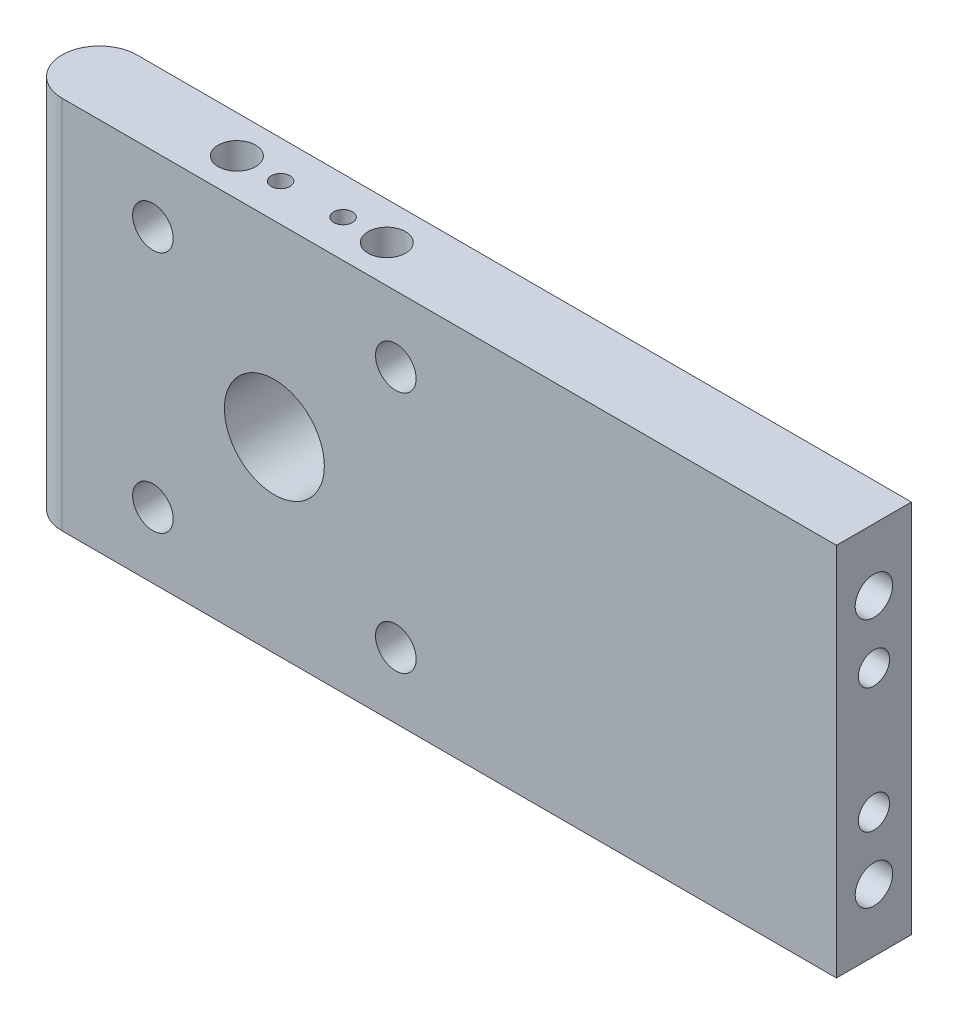
from build123d import *

# Parameters (mm, degrees)
SKETCH1_W           = 130
SKETCH1_H           = 60
SKETCH1_R           = 8
SKETCH1_R_2         = 3.25
BOSS_EXTRUDE1_DEPTH = 12
FILLET1_R           = 6
SKETCH2_R           = 3
SKETCH2_R_2         = 2.5
CUT_EXTRUDE1_DEPTH  = 20
SKETCH3_R           = 3
SKETCH3_R_2         = 1.5
CUT_EXTRUDE2_DEPTH  = 15


with BuildPart() as part:
    # Sketch1 → Boss-Extrude1 (new body)
    with BuildSketch(Plane.XY):
        Rectangle(SKETCH1_W, SKETCH1_H)
        with Locations((-25, 0)):
            Circle(SKETCH1_R, mode=Mode.SUBTRACT)
        with Locations((-5.554563517, 19.445436483)):
            Circle(SKETCH1_R_2, mode=Mode.SUBTRACT)
        with Locations((-44.445436483, 19.445436483)):
            Circle(SKETCH1_R_2, mode=Mode.SUBTRACT)
        with Locations(Location((-44.445436483, -19.445436483, 0), (0, 0, 180))):
            Circle(SKETCH1_R_2, mode=Mode.SUBTRACT)
        with Locations(Location((-5.554563517, -19.445436483, 0), (0, 0, 180))):
            Circle(SKETCH1_R_2, mode=Mode.SUBTRACT)
    extrude(amount=BOSS_EXTRUDE1_DEPTH)

    # Fillet1
    fillet1_edges = [part.edges().sort_by_distance(p)[0] for p in [
        (-65, 0, 0),
        (-65, 0, 12),
    ]]
    fillet(fillet1_edges, radius=FILLET1_R - 0.0001)  # a hair under: the kernel refuses the full size

    # Sketch2 → Cut-Extrude1 (cut)
    with BuildSketch(Plane(origin=(65, 0, 0), x_dir=(0, 0, -1), z_dir=(1, 0, 0))):
        with Locations((-6, 20)):
            Circle(SKETCH2_R)
        with Locations((-6, 10)):
            Circle(SKETCH2_R_2)
        with Locations(Location((-6, -10, 0), (0, 0, 180))):
            Circle(SKETCH2_R_2)
        with Locations(Location((-6, -20, 0), (0, 0, 180))):
            Circle(SKETCH2_R)
    extrude(amount=-CUT_EXTRUDE1_DEPTH, mode=Mode.SUBTRACT)

    # Sketch3 → Cut-Extrude2 (cut)
    with BuildSketch(Plane(origin=(0, 30, 0), x_dir=(1, 0, 0), z_dir=(0, 1, 0))):
        with Locations(Location((-13, -6, 0), (0, 0, 270))):
            Circle(SKETCH3_R)
        with Locations(Location((-20, -6, 0), (0, 0, 270))):
            Circle(SKETCH3_R_2)
        with Locations(Location((-30, -6, 0), (0, 0, 90))):
            Circle(SKETCH3_R_2)
        with Locations(Location((-37, -6, 0), (0, 0, 90))):
            Circle(SKETCH3_R)
    extrude(amount=-CUT_EXTRUDE2_DEPTH, mode=Mode.SUBTRACT)


solid = part.part
